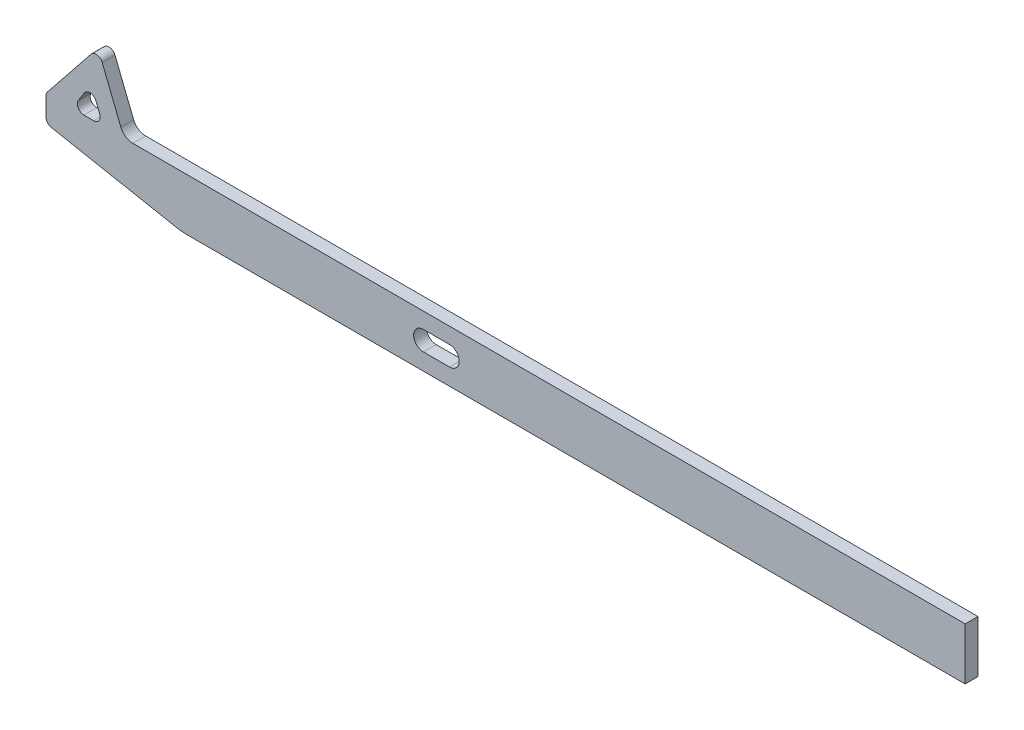
from build123d import *

# Parameters (mm, degrees)
BOSS_EXTRUDE1_DEPTH = 3.1242
FILLET4_R           = 12.7
FILLET8_R           = 1.5875
FILLET9_R           = 3.175
CUT_EXTRUDE1_DEPTH  = 116.691473387


with BuildPart() as part:
    # Sketch1 → Boss-Extrude1 (new body)
    with BuildSketch(Plane.XY):
        Polygon((113.799832915, -6.443650697), (-77.372532393, -6.443650697), (-110.491946085, -0.093650697), (-110.491946085, 6.256349303), (-97.791946085, 22.131349303), (-91.441946085, 6.256349303), (113.799832915, 6.256349303), align=None)
        Polygon((-104.141946085, 6.256349303), (-99.460780317, 13.603434884), (-96.521946085, 6.256349303), align=None, mode=Mode.SUBTRACT)
    extrude(amount=BOSS_EXTRUDE1_DEPTH)

    # Fillet4
    fillet4_edges = [part.edges().sort_by_distance(p)[0] for p in [
        (-77.372532393, -6.443650697, 1.5621),
    ]]
    fillet(fillet4_edges, radius=FILLET4_R)

    # Fillet8
    fillet8_edges = [part.edges().sort_by_distance(p)[0] for p in [
        (-110.491946085, -0.093650697, 1.5621),
        (-110.491946085, 6.256349303, 1.5621),
        (-97.791946085, 22.131349303, 1.5621),
        (-99.460780317, 13.603434884, 1.5621),
        (-104.141946085, 6.256349303, 1.5621),
        (-96.521946085, 6.256349303, 1.5621),
    ]]
    fillet(fillet8_edges, radius=FILLET8_R)

    # Fillet9
    fillet9_edges = [part.edges().sort_by_distance(p)[0] for p in [
        (-91.441946085, 6.256349303, 1.5621),
    ]]
    fillet(fillet9_edges, radius=FILLET9_R)

    # Sketch2 → Cut-Extrude1 (cut, through all)
    with BuildSketch(Plane.XY.offset(3.1242)):
        with BuildLine():
            Line((-18.407167085, 2.38125), (-12.057167085, 2.38125))
            ThreePointArc((-12.057167085, 2.38125), (-9.675917085, 0), (-12.057167085, -2.38125))
            Line((-12.057167085, -2.38125), (-18.407167085, -2.38125))
            ThreePointArc((-18.407167085, -2.38125), (-20.788417085, 0), (-18.407167085, 2.38125))
        make_face()
    extrude(amount=-CUT_EXTRUDE1_DEPTH, mode=Mode.SUBTRACT)


solid = part.part
